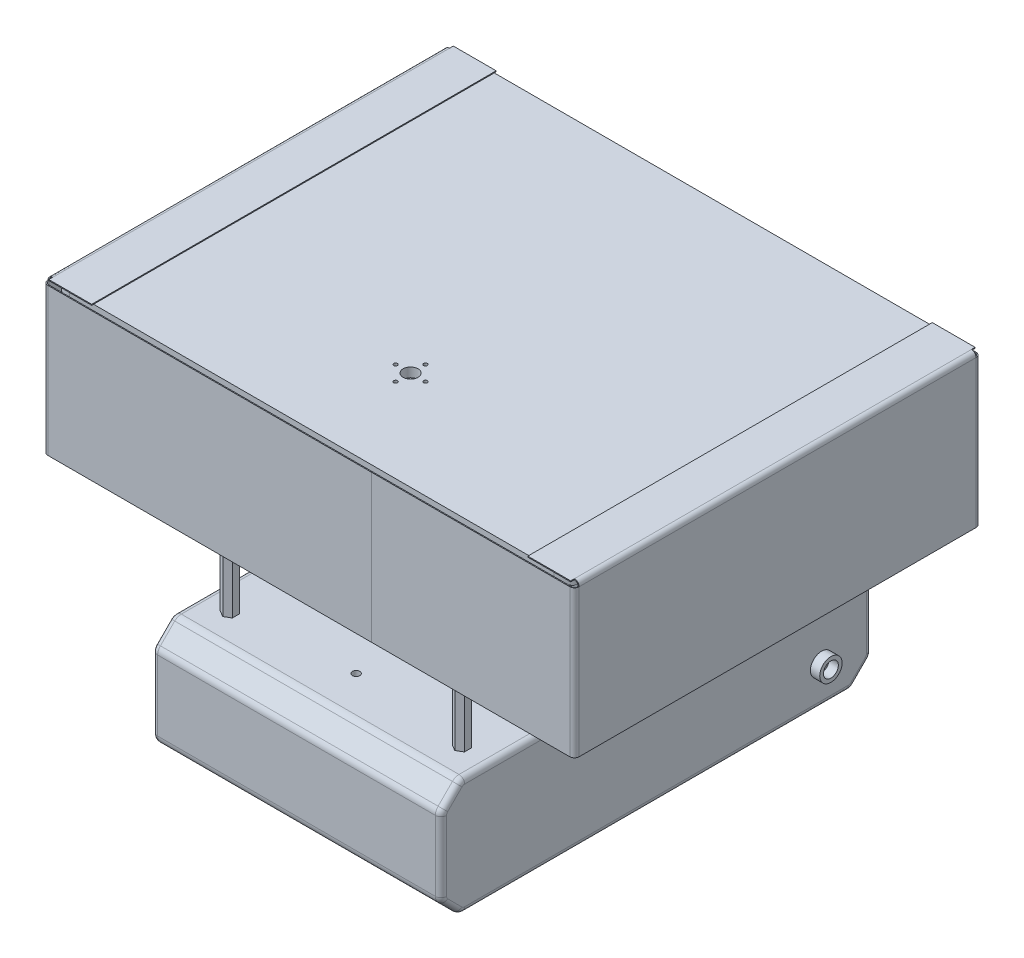
from build123d import *

# Parameters (mm, degrees)
BOSS_EXTRUDE1_DEPTH                  = 77.5
FILLET1_R                            = 5
FILLET2_R                            = 3
SKETCH2_R                            = 6
SKETCH2_R_2                          = 4
BOSS_EXTRUDE2_DEPTH                  = 5
BOSS_EXTRUDE3_DEPTH                  = 44
BOSS_EXTRUDE3_2_DEPTH                = 44
BOSS_EXTRUDE3_3_DEPTH                = 44
BOSS_EXTRUDE3_4_DEPTH                = 44
BOSS_EXTRUDE3_5_DEPTH                = 44
BOSS_EXTRUDE3_6_DEPTH                = 44
BOSS_EXTRUDE4_DEPTH                  = 5
BOSS_EXTRUDE5_DEPTH                  = 71
BOSS_EXTRUDE5_2_DEPTH                = 71
BOSS_EXTRUDE5_3_DEPTH                = 71
BOSS_EXTRUDE5_4_DEPTH                = 71
BOSS_EXTRUDE5_5_DEPTH                = 71
BOSS_EXTRUDE5_6_DEPTH                = 71
BOSS_EXTRUDE6_DEPTH                  = 5
BOSS_EXTRUDE7_DEPTH                  = 17
BOSS_EXTRUDE7_2_DEPTH                = 17
BOSS_EXTRUDE7_3_DEPTH                = 17
BOSS_EXTRUDE7_4_DEPTH                = 17
BOSS_EXTRUDE8_DEPTH                  = 3
TAP_DRILL_FOR_M4X0_7_TAP1_AT_2_COUNT = 2
TAP_DRILL_FOR_M4X0_7_TAP1_AT_2_PITCH = 60.74722325
TAP_DRILL_FOR_M4X0_7_TAP1_AT_3_COUNT = 2
TAP_DRILL_FOR_M4X0_7_TAP1_AT_3_PITCH = 121.494446501
TAP_DRILL_FOR_M4X0_7_TAP1_AT_4_COUNT = 2
TAP_DRILL_FOR_M4X0_7_TAP1_AT_4_PITCH = 283.367077358
TAP_DRILL_FOR_M4X0_7_TAP1_AT_5_COUNT = 2
TAP_DRILL_FOR_M4X0_7_TAP1_AT_5_PITCH = 263.108770535
TAP_DRILL_FOR_M4X0_7_TAP1_AT_6_COUNT = 2
TAP_DRILL_FOR_M4X0_7_TAP1_AT_6_PITCH = 256
TAP_DRILL_FOR_M4X0_7_TAP2_AT_2_COUNT = 2
TAP_DRILL_FOR_M4X0_7_TAP2_AT_2_PITCH = 60.74722325
TAP_DRILL_FOR_M4X0_7_TAP2_AT_3_COUNT = 2
TAP_DRILL_FOR_M4X0_7_TAP2_AT_3_PITCH = 121.494446501
TAP_DRILL_FOR_M4X0_7_TAP2_AT_4_COUNT = 2
TAP_DRILL_FOR_M4X0_7_TAP2_AT_4_PITCH = 283.367077358
TAP_DRILL_FOR_M4X0_7_TAP2_AT_5_COUNT = 2
TAP_DRILL_FOR_M4X0_7_TAP2_AT_5_PITCH = 263.108770535
TAP_DRILL_FOR_M4X0_7_TAP2_AT_6_COUNT = 2
TAP_DRILL_FOR_M4X0_7_TAP2_AT_6_PITCH = 256
SKETCH17_W                           = 25
SKETCH17_H                           = 217
BASE_FLANGE1_DEPTH                   = 0.5
EDGE_FLANGE1_STRIP_W                 = 6
EDGE_FLANGE1_STRIP_H                 = 0.5
EDGE_FLANGE1_STRIP_CUT_DEPTH         = 217
EDGE_FLANGE1_DEPTH                   = 217
EDGE_FLANGE2_START                   = 107
EDGE_FLANGE2_DEPTH                   = 81.5
EDGE_FLANGE2_START_2                 = 186
EDGE_FLANGE2_2_DEPTH                 = 2.5
EDGE_FLANGE2_3_DEPTH                 = 79
EDGE_FLANGE3_START                   = 107
EDGE_FLANGE3_DEPTH                   = 81.5
EDGE_FLANGE3_START_2                 = 186
EDGE_FLANGE3_2_DEPTH                 = 2.5
EDGE_FLANGE3_3_DEPTH                 = 79
SKETCH41_R                           = 4
SKETCH41_R_2                         = 1
CUT_EXTRUDE1_DEPTH                   = 5
SKETCH42_R                           = 2
CUT_EXTRUDE2_DEPTH                   = 63


# Read off the part's stored shape, not the designer's step: Edge-Flange2, Edge-Flange3
# Sheet-metal steps are written as plain solids
with BuildPart() as part:
    # Sketch1 → Boss-Extrude1 (new, symmetric)
    with BuildSketch(Plane(origin=(0, 0, 0), x_dir=(0, 0, -1), z_dir=(1, 0, 0))):
        Polygon((-105, 0), (105, 0), (115.606601718, 10.606601718), (115.606601718, 52.393398282), (105, 63), (-105, 63), (-115.606601718, 52.393398282), (-115.606601718, 10.606601718), align=None)
    extrude(amount=BOSS_EXTRUDE1_DEPTH, both=True)

    # Fillet1
    fillet1_edges = [part.edges().sort_by_distance(p)[0] for p in [
        (0, 10.606601718, 115.606601718),
        (0, 52.393398282, 115.606601718),
        (0, 63, 105),
        (0, 63, -105),
        (0, 52.393398282, -115.606601718),
        (0, 10.606601718, -115.606601718),
        (0, 0, -105),
        (0, 0, 105),
    ]]
    fillet(fillet1_edges, radius=FILLET1_R)

    # Fillet2
    fillet2_edges = [part.edges().sort_by_distance(p)[0] for p in [
        (-77.5, 63, 0),
        (77.5, 63, 0),
        (-77.5, 5.303300859, 110.303300859),
        (-77.5, 31.5, 115.606601718),
        (-77.5, 57.696699141, 110.303300859),
        (-77.5, 57.696699141, -110.303300859),
        (-77.5, 31.5, -115.606601718),
        (-77.5, 5.303300859, -110.303300859),
        (-77.5, 0, 0),
        (-77.5, 62.619397663, 104.84234935),
        (-77.5, 52.235747632, 115.22599938),
        (-77.5, 10.764252368, 115.22599938),
        (-77.5, 0.380602337, 104.84234935),
        (-77.5, 0.380602337, -104.84234935),
        (-77.5, 10.764252368, -115.22599938),
        (-77.5, 52.235747632, -115.22599938),
        (-77.5, 62.619397663, -104.84234935),
        (77.5, 57.696699141, -110.303300859),
        (77.5, 5.303300859, 110.303300859),
        (77.5, 0, 0),
        (77.5, 5.303300859, -110.303300859),
        (77.5, 31.5, -115.606601718),
        (77.5, 57.696699141, 110.303300859),
        (77.5, 31.5, 115.606601718),
        (77.5, 62.619397663, 104.84234935),
        (77.5, 52.235747632, 115.22599938),
        (77.5, 10.764252368, 115.22599938),
        (77.5, 0.380602337, 104.84234935),
        (77.5, 0.380602337, -104.84234935),
        (77.5, 10.764252368, -115.22599938),
        (77.5, 52.235747632, -115.22599938),
        (77.5, 62.619397663, -104.84234935),
    ]]
    fillet(fillet2_edges, radius=FILLET2_R)

    # Sketch2 → Boss-Extrude2 (add)
    with BuildSketch(Plane.ZY.offset(77.5)):
        with Locations((-88.606601718, 20)):
            Circle(SKETCH2_R)
        with Locations((-88.606601718, 20)):
            Circle(SKETCH2_R_2, mode=Mode.SUBTRACT)
    boss_extrude2 = extrude(amount=BOSS_EXTRUDE2_DEPTH)

    # Mirror1: Boss-Extrude2 across plane
    add(boss_extrude2.mirror(Plane(origin=(0, 0, 0), x_dir=(0, 0, 1), z_dir=(1, 0, 0))))

    # Sketch42 → Cut-Extrude2 (cut)
    with BuildSketch(Plane.XZ):
        with Locations(Location((0, 83.642935588, 0), (0, 0, 270))):
            Circle(SKETCH42_R)
    extrude(amount=-CUT_EXTRUDE2_DEPTH, mode=Mode.SUBTRACT)


with BuildPart() as body_2:
    # Sketch3 → Boss-Extrude3 (new body)
    with BuildSketch(Plane(origin=(0, 63, 0), x_dir=(1, 0, 0), z_dir=(0, 1, 0))):
        Polygon((-62.25, 85.423378689), (-59, 87.299767064), (-59, 91.052543813), (-62.25, 92.928932188), (-65.5, 91.052543813), (-65.5, 87.299767064), align=None)
    extrude(amount=BOSS_EXTRUDE3_DEPTH)


with BuildPart() as body_3:
    # Sketch3 → Boss-Extrude3 2 (new body)
    with BuildSketch(Plane(origin=(0, 63, 0), x_dir=(1, 0, 0), z_dir=(0, 1, 0))):
        Polygon((65.5, 87.299767064), (62.25, 85.423378689), (59, 87.299767064), (59, 91.052543813), (62.25, 92.928932188), (65.5, 91.052543813), align=None)
    extrude(amount=BOSS_EXTRUDE3_2_DEPTH)


with BuildPart() as body_4:
    # Sketch3 → Boss-Extrude3 3 (new body)
    with BuildSketch(Plane(origin=(0, 63, 0), x_dir=(1, 0, 0), z_dir=(0, 1, 0))):
        Polygon((-62.25, -3.75277675), (-59, -1.876388375), (-59, 1.876388375), (-62.25, 3.75277675), (-65.5, 1.876388375), (-65.5, -1.876388375), align=None)
    extrude(amount=BOSS_EXTRUDE3_3_DEPTH)


with BuildPart() as body_5:
    # Sketch3 → Boss-Extrude3 4 (new body)
    with BuildSketch(Plane(origin=(0, 63, 0), x_dir=(1, 0, 0), z_dir=(0, 1, 0))):
        Polygon((62.25, -3.75277675), (59, -1.876388375), (59, 1.876388375), (62.25, 3.75277675), (65.5, 1.876388375), (65.5, -1.876388375), align=None)
    extrude(amount=BOSS_EXTRUDE3_4_DEPTH)


with BuildPart() as body_6:
    # Sketch3 → Boss-Extrude3 5 (new body)
    with BuildSketch(Plane(origin=(0, 63, 0), x_dir=(1, 0, 0), z_dir=(0, 1, 0))):
        Polygon((-62.25, -92.928932188), (-59, -91.052543813), (-59, -87.299767064), (-62.25, -85.423378689), (-65.5, -87.299767064), (-65.5, -91.052543813), align=None)
    extrude(amount=BOSS_EXTRUDE3_5_DEPTH)


with BuildPart() as body_7:
    # Sketch3 → Boss-Extrude3 6 (new body)
    with BuildSketch(Plane(origin=(0, 63, 0), x_dir=(1, 0, 0), z_dir=(0, 1, 0))):
        Polygon((62.25, -92.928932188), (59, -91.052543813), (59, -87.299767064), (62.25, -85.423378689), (65.5, -87.299767064), (65.5, -91.052543813), align=None)
    extrude(amount=BOSS_EXTRUDE3_6_DEPTH)


with BuildPart() as body_8:
    # Sketch4 → Boss-Extrude4 (new body)
    with BuildSketch(Plane(origin=(0, 107, 0), x_dir=(1, 0, 0), z_dir=(0, 1, 0))):
        with BuildLine():
            Line((130, -107.5), (-130, -107.5))
            ThreePointArc((-130, -107.5), (-137.071067812, -104.571067812), (-140, -97.5))
            Line((-140, -97.5), (-140, 97.5))
            ThreePointArc((-140, 97.5), (-137.071067812, 104.571067812), (-130, 107.5))
            Line((-130, 107.5), (130, 107.5))
            ThreePointArc((130, 107.5), (137.071067812, 104.571067812), (140, 97.5))
            Line((140, 97.5), (140, -97.5))
            ThreePointArc((140, -97.5), (137.071067812, -104.571067812), (130, -107.5))
        make_face()
    extrude(amount=BOSS_EXTRUDE4_DEPTH)


with BuildPart() as body_9:
    # Sketch5 → Boss-Extrude5 (new body)
    with BuildSketch(Plane(origin=(0, 112, 0), x_dir=(1, 0, 0), z_dir=(0, 1, 0))):
        Polygon((-131.25, 58.870834875), (-128, 56.994446501), (-124.75, 58.870834875), (-124.75, 62.623611625), (-128, 64.5), (-131.25, 62.623611625), align=None)
    extrude(amount=BOSS_EXTRUDE5_DEPTH)


with BuildPart() as body_10:
    # Sketch5 → Boss-Extrude5 2 (new body)
    with BuildSketch(Plane(origin=(0, 112, 0), x_dir=(1, 0, 0), z_dir=(0, 1, 0))):
        Polygon((131.25, 62.623611625), (131.25, 58.870834875), (128, 56.994446501), (124.75, 58.870834875), (124.75, 62.623611625), (128, 64.5), align=None)
    extrude(amount=BOSS_EXTRUDE5_2_DEPTH)


with BuildPart() as body_11:
    # Sketch5 → Boss-Extrude5 3 (new body)
    with BuildSketch(Plane(origin=(0, 112, 0), x_dir=(1, 0, 0), z_dir=(0, 1, 0))):
        Polygon((-128, -3.75277675), (-124.75, -1.876388375), (-124.75, 1.876388375), (-128, 3.75277675), (-131.25, 1.876388375), (-131.25, -1.876388375), align=None)
    extrude(amount=BOSS_EXTRUDE5_3_DEPTH)


with BuildPart() as body_12:
    # Sketch5 → Boss-Extrude5 4 (new body)
    with BuildSketch(Plane(origin=(0, 112, 0), x_dir=(1, 0, 0), z_dir=(0, 1, 0))):
        Polygon((131.25, -1.876388375), (128, -3.75277675), (124.75, -1.876388375), (124.75, 1.876388375), (128, 3.75277675), (131.25, 1.876388375), align=None)
    extrude(amount=BOSS_EXTRUDE5_4_DEPTH)


with BuildPart() as body_13:
    # Sketch5 → Boss-Extrude5 5 (new body)
    with BuildSketch(Plane(origin=(0, 112, 0), x_dir=(1, 0, 0), z_dir=(0, 1, 0))):
        Polygon((-128, -64.5), (-124.75, -62.623611625), (-124.75, -58.870834875), (-128, -56.994446501), (-131.25, -58.870834875), (-131.25, -62.623611625), align=None)
    extrude(amount=BOSS_EXTRUDE5_5_DEPTH)


with BuildPart() as body_14:
    # Sketch5 → Boss-Extrude5 6 (new body)
    with BuildSketch(Plane(origin=(0, 112, 0), x_dir=(1, 0, 0), z_dir=(0, 1, 0))):
        Polygon((131.25, -62.623611625), (128, -64.5), (124.75, -62.623611625), (124.75, -58.870834875), (128, -56.994446501), (131.25, -58.870834875), align=None)
    extrude(amount=BOSS_EXTRUDE5_6_DEPTH)


with BuildPart() as body_15:
    # Sketch6 → Boss-Extrude6 (new body)
    with BuildSketch(Plane(origin=(0, 183, 0), x_dir=(1, 0, 0), z_dir=(0, 1, 0))):
        with BuildLine():
            Line((-140, 97.5), (-140, -97.5))
            ThreePointArc((-140, -97.5), (-137.071067812, -104.571067812), (-130, -107.5))
            Line((-130, -107.5), (130, -107.5))
            ThreePointArc((130, -107.5), (137.071067812, -104.571067812), (140, -97.5))
            Line((140, -97.5), (140, 97.5))
            ThreePointArc((140, 97.5), (137.071067812, 104.571067812), (130, 107.5))
            Line((130, 107.5), (-130, 107.5))
            ThreePointArc((-130, 107.5), (-137.071067812, 104.571067812), (-140, 97.5))
        make_face()
    extrude(amount=BOSS_EXTRUDE6_DEPTH)


with BuildPart() as body_16:
    # Sketch7 → Boss-Extrude7 (new body)
    with BuildSketch(Plane(origin=(0, 112, 0), x_dir=(1, 0, 0), z_dir=(0, 1, 0))):
        Polygon((-53.25, 48.123611625), (-50, 46.24722325), (-46.75, 48.123611625), (-46.75, 51.876388375), (-50, 53.75277675), (-53.25, 51.876388375), align=None)
    extrude(amount=BOSS_EXTRUDE7_DEPTH)


with BuildPart() as body_17:
    # Sketch7 → Boss-Extrude7 2 (new body)
    with BuildSketch(Plane(origin=(0, 112, 0), x_dir=(1, 0, 0), z_dir=(0, 1, 0))):
        Polygon((53.25, 51.876388375), (53.25, 48.123611625), (50, 46.24722325), (46.75, 48.123611625), (46.75, 51.876388375), (50, 53.75277675), align=None)
    extrude(amount=BOSS_EXTRUDE7_2_DEPTH)


with BuildPart() as body_18:
    # Sketch7 → Boss-Extrude7 3 (new body)
    with BuildSketch(Plane(origin=(0, 112, 0), x_dir=(1, 0, 0), z_dir=(0, 1, 0))):
        Polygon((53.25, -48.123611625), (50, -46.24722325), (46.75, -48.123611625), (46.75, -51.876388375), (50, -53.75277675), (53.25, -51.876388375), align=None)
    extrude(amount=BOSS_EXTRUDE7_3_DEPTH)


with BuildPart() as body_19:
    # Sketch7 → Boss-Extrude7 4 (new body)
    with BuildSketch(Plane(origin=(0, 112, 0), x_dir=(1, 0, 0), z_dir=(0, 1, 0))):
        Polygon((-53.25, -51.876388375), (-53.25, -48.123611625), (-50, -46.24722325), (-46.75, -48.123611625), (-46.75, -51.876388375), (-50, -53.75277675), align=None)
    extrude(amount=BOSS_EXTRUDE7_4_DEPTH)


with BuildPart() as body_20:
    # Sketch8 → Boss-Extrude8 (new body)
    with BuildSketch(Plane(origin=(0, 129, 0), x_dir=(1, 0, 0), z_dir=(0, 1, 0))):
        with BuildLine():
            Line((52.5, -62.5), (-52.5, -62.5))
            ThreePointArc((-52.5, -62.5), (-59.571067812, -59.571067812), (-62.5, -52.5))
            Line((-62.5, -52.5), (-62.5, 52.5))
            ThreePointArc((-62.5, 52.5), (-59.571067812, 59.571067812), (-52.5, 62.5))
            Line((-52.5, 62.5), (52.5, 62.5))
            ThreePointArc((52.5, 62.5), (59.571067812, 59.571067812), (62.5, 52.5))
            Line((62.5, 52.5), (62.5, -52.5))
            ThreePointArc((62.5, -52.5), (59.571067812, -59.571067812), (52.5, -62.5))
        make_face()
    extrude(amount=BOSS_EXTRUDE8_DEPTH)


with BuildPart() as tap_drill_for_m4x0_7_tap1_tool:
    # Sketch11 → Tap Drill for M4x0.7 Tap1 (revolve)
    with BuildSketch(Plane(origin=(-128, 188, 60.74722325), x_dir=(0, 0, 1), z_dir=(1, 0, 0))):
        Polygon((0, 0), (0, 12.991420021), (1.65, 12), (1.65, 0), align=None)
    tap_drill_for_m4x0_7_tap1 = revolve(axis=Axis((-128, 194.35, 60.74722325), (0, -1, 0)))


with BuildPart() as body_13_1:
    add(body_13.part)

    # Tap Drill for M4x0.7 Tap1: cut by tap_drill_for_m4x0_7_tap1_tool
    add(tap_drill_for_m4x0_7_tap1_tool.part, mode=Mode.SUBTRACT)


with BuildPart() as body_15_1:
    add(body_15.part)

    # Tap Drill for M4x0.7 Tap1: cut by tap_drill_for_m4x0_7_tap1_tool
    add(tap_drill_for_m4x0_7_tap1_tool.part, mode=Mode.SUBTRACT)


with BuildPart() as tap_drill_for_m4x0_7_tap1_at_2_tool:
    # Tap Drill for M4x0.7 Tap1 at 2: Tap Drill for M4x0.7 Tap1 ×2
    with Locations(*[(0, 0, -i * TAP_DRILL_FOR_M4X0_7_TAP1_AT_2_PITCH) for i in range(1, TAP_DRILL_FOR_M4X0_7_TAP1_AT_2_COUNT)]):
        add(tap_drill_for_m4x0_7_tap1)


with BuildPart() as body_11_1:
    add(body_11.part)

    # Tap Drill for M4x0.7 Tap1 at 2: cut by tap_drill_for_m4x0_7_tap1_at_2_tool
    add(tap_drill_for_m4x0_7_tap1_at_2_tool.part, mode=Mode.SUBTRACT)


with BuildPart() as body_15_2:
    add(body_15_1.part)

    # Tap Drill for M4x0.7 Tap1 at 2: cut by tap_drill_for_m4x0_7_tap1_at_2_tool
    add(tap_drill_for_m4x0_7_tap1_at_2_tool.part, mode=Mode.SUBTRACT)


with BuildPart() as tap_drill_for_m4x0_7_tap1_at_3_tool:
    # Tap Drill for M4x0.7 Tap1 at 3: Tap Drill for M4x0.7 Tap1 ×2
    with Locations(*[(0, 0, -i * TAP_DRILL_FOR_M4X0_7_TAP1_AT_3_PITCH) for i in range(1, TAP_DRILL_FOR_M4X0_7_TAP1_AT_3_COUNT)]):
        add(tap_drill_for_m4x0_7_tap1)


with BuildPart() as body_9_1:
    add(body_9.part)

    # Tap Drill for M4x0.7 Tap1 at 3: cut by tap_drill_for_m4x0_7_tap1_at_3_tool
    add(tap_drill_for_m4x0_7_tap1_at_3_tool.part, mode=Mode.SUBTRACT)


with BuildPart() as body_15_3:
    add(body_15_2.part)

    # Tap Drill for M4x0.7 Tap1 at 3: cut by tap_drill_for_m4x0_7_tap1_at_3_tool
    add(tap_drill_for_m4x0_7_tap1_at_3_tool.part, mode=Mode.SUBTRACT)


with BuildPart() as tap_drill_for_m4x0_7_tap1_at_4_tool:
    # Tap Drill for M4x0.7 Tap1 at 4: Tap Drill for M4x0.7 Tap1 ×2
    with Locations(*[Vector(0.9034218173358387, 0, -0.42875286583486594) * (i * TAP_DRILL_FOR_M4X0_7_TAP1_AT_4_PITCH) for i in range(1, TAP_DRILL_FOR_M4X0_7_TAP1_AT_4_COUNT)]):
        add(tap_drill_for_m4x0_7_tap1)


with BuildPart() as body_10_1:
    add(body_10.part)

    # Tap Drill for M4x0.7 Tap1 at 4: cut by tap_drill_for_m4x0_7_tap1_at_4_tool
    add(tap_drill_for_m4x0_7_tap1_at_4_tool.part, mode=Mode.SUBTRACT)


with BuildPart() as body_15_4:
    add(body_15_3.part)

    # Tap Drill for M4x0.7 Tap1 at 4: cut by tap_drill_for_m4x0_7_tap1_at_4_tool
    add(tap_drill_for_m4x0_7_tap1_at_4_tool.part, mode=Mode.SUBTRACT)


with BuildPart() as tap_drill_for_m4x0_7_tap1_at_5_tool:
    # Tap Drill for M4x0.7 Tap1 at 5: Tap Drill for M4x0.7 Tap1 ×2
    with Locations(*[Vector(0.972981628393172, 0, -0.23088254765003635) * (i * TAP_DRILL_FOR_M4X0_7_TAP1_AT_5_PITCH) for i in range(1, TAP_DRILL_FOR_M4X0_7_TAP1_AT_5_COUNT)]):
        add(tap_drill_for_m4x0_7_tap1)


with BuildPart() as body_12_1:
    add(body_12.part)

    # Tap Drill for M4x0.7 Tap1 at 5: cut by tap_drill_for_m4x0_7_tap1_at_5_tool
    add(tap_drill_for_m4x0_7_tap1_at_5_tool.part, mode=Mode.SUBTRACT)


with BuildPart() as body_15_5:
    add(body_15_4.part)

    # Tap Drill for M4x0.7 Tap1 at 5: cut by tap_drill_for_m4x0_7_tap1_at_5_tool
    add(tap_drill_for_m4x0_7_tap1_at_5_tool.part, mode=Mode.SUBTRACT)


with BuildPart() as tap_drill_for_m4x0_7_tap1_at_6_tool:
    # Tap Drill for M4x0.7 Tap1 at 6: Tap Drill for M4x0.7 Tap1 ×2
    with Locations(*[(i * TAP_DRILL_FOR_M4X0_7_TAP1_AT_6_PITCH, 0, 0) for i in range(1, TAP_DRILL_FOR_M4X0_7_TAP1_AT_6_COUNT)]):
        add(tap_drill_for_m4x0_7_tap1)


with BuildPart() as body_14_1:
    add(body_14.part)

    # Tap Drill for M4x0.7 Tap1 at 6: cut by tap_drill_for_m4x0_7_tap1_at_6_tool
    add(tap_drill_for_m4x0_7_tap1_at_6_tool.part, mode=Mode.SUBTRACT)


with BuildPart() as body_15_6:
    add(body_15_5.part)

    # Tap Drill for M4x0.7 Tap1 at 6: cut by tap_drill_for_m4x0_7_tap1_at_6_tool
    add(tap_drill_for_m4x0_7_tap1_at_6_tool.part, mode=Mode.SUBTRACT)

    # Sketch41 → Cut-Extrude1 (cut)
    with BuildSketch(Plane(origin=(0, 188, 0), x_dir=(1, 0, 0), z_dir=(0, 1, 0))):
        with Locations(Location((0, -54.420564453, 0), (0, 0, 270))):
            Circle(SKETCH41_R)
        with Locations(Location((0, -46.420564453, 0), (0, 0, 270))):
            Circle(SKETCH41_R_2)
        with Locations(Location((-8.009435547, -54.43, 0), (0, 0, 270))):
            Circle(SKETCH41_R_2)
        with Locations(Location((0, -62.439435547, 0), (0, 0, 270))):
            Circle(SKETCH41_R_2)
        with Locations(Location((8.009435547, -54.43, 0), (0, 0, 270))):
            Circle(SKETCH41_R_2)
    extrude(amount=-CUT_EXTRUDE1_DEPTH, mode=Mode.SUBTRACT)


with BuildPart() as tap_drill_for_m4x0_7_tap2_tool:
    # Sketch15 → Tap Drill for M4x0.7 Tap2 (revolve)
    with BuildSketch(Plane(origin=(-128, 107, 60.74722325), x_dir=(0, 0, -1), z_dir=(1, 0, 0))):
        Polygon((0, 0), (0, 12.991420021), (1.65, 12), (1.65, 0), align=None)
    tap_drill_for_m4x0_7_tap2 = revolve(axis=Axis((-128, 100.65, 60.74722325), (0, 1, 0)))


with BuildPart() as body_8_1:
    add(body_8.part)

    # Tap Drill for M4x0.7 Tap2: cut by tap_drill_for_m4x0_7_tap2_tool
    add(tap_drill_for_m4x0_7_tap2_tool.part, mode=Mode.SUBTRACT)


with BuildPart() as body_13_2:
    add(body_13_1.part)

    # Tap Drill for M4x0.7 Tap2: cut by tap_drill_for_m4x0_7_tap2_tool
    add(tap_drill_for_m4x0_7_tap2_tool.part, mode=Mode.SUBTRACT)


with BuildPart() as tap_drill_for_m4x0_7_tap2_at_2_tool:
    # Tap Drill for M4x0.7 Tap2 at 2: Tap Drill for M4x0.7 Tap2 ×2
    with Locations(*[(0, 0, -i * TAP_DRILL_FOR_M4X0_7_TAP2_AT_2_PITCH) for i in range(1, TAP_DRILL_FOR_M4X0_7_TAP2_AT_2_COUNT)]):
        add(tap_drill_for_m4x0_7_tap2)


with BuildPart() as body_8_2:
    add(body_8_1.part)

    # Tap Drill for M4x0.7 Tap2 at 2: cut by tap_drill_for_m4x0_7_tap2_at_2_tool
    add(tap_drill_for_m4x0_7_tap2_at_2_tool.part, mode=Mode.SUBTRACT)


with BuildPart() as body_11_2:
    add(body_11_1.part)

    # Tap Drill for M4x0.7 Tap2 at 2: cut by tap_drill_for_m4x0_7_tap2_at_2_tool
    add(tap_drill_for_m4x0_7_tap2_at_2_tool.part, mode=Mode.SUBTRACT)


with BuildPart() as tap_drill_for_m4x0_7_tap2_at_3_tool:
    # Tap Drill for M4x0.7 Tap2 at 3: Tap Drill for M4x0.7 Tap2 ×2
    with Locations(*[(0, 0, -i * TAP_DRILL_FOR_M4X0_7_TAP2_AT_3_PITCH) for i in range(1, TAP_DRILL_FOR_M4X0_7_TAP2_AT_3_COUNT)]):
        add(tap_drill_for_m4x0_7_tap2)


with BuildPart() as body_8_3:
    add(body_8_2.part)

    # Tap Drill for M4x0.7 Tap2 at 3: cut by tap_drill_for_m4x0_7_tap2_at_3_tool
    add(tap_drill_for_m4x0_7_tap2_at_3_tool.part, mode=Mode.SUBTRACT)


with BuildPart() as body_9_2:
    add(body_9_1.part)

    # Tap Drill for M4x0.7 Tap2 at 3: cut by tap_drill_for_m4x0_7_tap2_at_3_tool
    add(tap_drill_for_m4x0_7_tap2_at_3_tool.part, mode=Mode.SUBTRACT)


with BuildPart() as tap_drill_for_m4x0_7_tap2_at_4_tool:
    # Tap Drill for M4x0.7 Tap2 at 4: Tap Drill for M4x0.7 Tap2 ×2
    with Locations(*[Vector(0.9034218173358387, 0, -0.42875286583486594) * (i * TAP_DRILL_FOR_M4X0_7_TAP2_AT_4_PITCH) for i in range(1, TAP_DRILL_FOR_M4X0_7_TAP2_AT_4_COUNT)]):
        add(tap_drill_for_m4x0_7_tap2)


with BuildPart() as body_8_4:
    add(body_8_3.part)

    # Tap Drill for M4x0.7 Tap2 at 4: cut by tap_drill_for_m4x0_7_tap2_at_4_tool
    add(tap_drill_for_m4x0_7_tap2_at_4_tool.part, mode=Mode.SUBTRACT)


with BuildPart() as body_10_2:
    add(body_10_1.part)

    # Tap Drill for M4x0.7 Tap2 at 4: cut by tap_drill_for_m4x0_7_tap2_at_4_tool
    add(tap_drill_for_m4x0_7_tap2_at_4_tool.part, mode=Mode.SUBTRACT)


with BuildPart() as tap_drill_for_m4x0_7_tap2_at_5_tool:
    # Tap Drill for M4x0.7 Tap2 at 5: Tap Drill for M4x0.7 Tap2 ×2
    with Locations(*[Vector(0.972981628393172, 0, -0.23088254765003635) * (i * TAP_DRILL_FOR_M4X0_7_TAP2_AT_5_PITCH) for i in range(1, TAP_DRILL_FOR_M4X0_7_TAP2_AT_5_COUNT)]):
        add(tap_drill_for_m4x0_7_tap2)


with BuildPart() as body_8_5:
    add(body_8_4.part)

    # Tap Drill for M4x0.7 Tap2 at 5: cut by tap_drill_for_m4x0_7_tap2_at_5_tool
    add(tap_drill_for_m4x0_7_tap2_at_5_tool.part, mode=Mode.SUBTRACT)


with BuildPart() as body_12_2:
    add(body_12_1.part)

    # Tap Drill for M4x0.7 Tap2 at 5: cut by tap_drill_for_m4x0_7_tap2_at_5_tool
    add(tap_drill_for_m4x0_7_tap2_at_5_tool.part, mode=Mode.SUBTRACT)


with BuildPart() as tap_drill_for_m4x0_7_tap2_at_6_tool:
    # Tap Drill for M4x0.7 Tap2 at 6: Tap Drill for M4x0.7 Tap2 ×2
    with Locations(*[(i * TAP_DRILL_FOR_M4X0_7_TAP2_AT_6_PITCH, 0, 0) for i in range(1, TAP_DRILL_FOR_M4X0_7_TAP2_AT_6_COUNT)]):
        add(tap_drill_for_m4x0_7_tap2)


with BuildPart() as body_8_6:
    add(body_8_5.part)

    # Tap Drill for M4x0.7 Tap2 at 6: cut by tap_drill_for_m4x0_7_tap2_at_6_tool
    add(tap_drill_for_m4x0_7_tap2_at_6_tool.part, mode=Mode.SUBTRACT)


with BuildPart() as body_14_2:
    add(body_14_1.part)

    # Tap Drill for M4x0.7 Tap2 at 6: cut by tap_drill_for_m4x0_7_tap2_at_6_tool
    add(tap_drill_for_m4x0_7_tap2_at_6_tool.part, mode=Mode.SUBTRACT)


with BuildPart() as body_21:
    # Sketch17 → Base-Flange1 (new body)
    with BuildSketch(Plane(origin=(0, 188, 0), x_dir=(1, 0, 0), z_dir=(0, 1, 0))):
        with Locations((129.5, 0)):
            Rectangle(SKETCH17_W, SKETCH17_H)
    extrude(amount=BASE_FLANGE1_DEPTH)

    # Edge-Flange1 strip (across the edge) → Edge-Flange1 strip cut (cut)
    with BuildSketch(Plane(origin=(142, 188, -108.5), x_dir=(-1, 0, 0), z_dir=(0, 0, 1))):
        with Locations((-1, -0.25)):
            Rectangle(EDGE_FLANGE1_STRIP_W, EDGE_FLANGE1_STRIP_H)
    extrude(amount=EDGE_FLANGE1_STRIP_CUT_DEPTH, mode=Mode.SUBTRACT)

    # Edge-Flange1 section (across the edge) → Edge-Flange1 (add)
    with BuildSketch(Plane(origin=(142, 188, -108.5), x_dir=(-1, 0, 0), z_dir=(0, 0, 1))):
        with BuildLine():
            Line((-0.5, 2), (-0.5, 81))
            Line((-0.5, 81), (0, 81))
            Line((0, 81), (0, 2))
            ThreePointArc((0, 2), (0.585786438, 0.585786438), (2, 0))
            Line((2, 0), (2, -0.5))
            ThreePointArc((2, -0.5), (0.232233047, 0.232233047), (-0.5, 2))
        make_face()
    extrude(amount=EDGE_FLANGE1_DEPTH)


with BuildPart() as body_22:
    # Mirror2: mirrored copy
    add(body_21.part.mirror(Plane(origin=(0, 0, 0), x_dir=(0, 0, 1), z_dir=(1, 0, 0))))

    # Edge-Flange3 outline → Edge-Flange3 (cut)
    with BuildSketch(Plane(origin=(0, 0, 0), x_dir=(1, 0, 0), z_dir=(0, 1, 0)).offset(EDGE_FLANGE3_START)):
        with BuildLine():
            ThreePointArc((-142, -106.5), (-141.414213562, -107.914213562), (-140, -108.5))
            Line((-140, -108.5), (-140, -106.5))
            Line((-140, -106.5), (-142, -106.5))
        make_face()
        with BuildLine():
            ThreePointArc((-141.5, -108.5), (-142.236067978, -107.618033989), (-142.5, -106.5))
            Line((-142.5, -106.5), (-142.5, -108.5))
            Line((-142.5, -108.5), (-141.5, -108.5))
        make_face()
        with BuildLine():
            ThreePointArc((-140, 108.5), (-141.414213562, 107.914213562), (-142, 106.5))
            Line((-142, 106.5), (-140, 106.5))
            Line((-140, 106.5), (-140, 108.5))
        make_face()
        with BuildLine():
            Line((-142.5, 108.5), (-142.5, 106.5))
            ThreePointArc((-142.5, 106.5), (-142.236067978, 107.618033989), (-141.5, 108.5))
            Line((-141.5, 108.5), (-142.5, 108.5))
        make_face()
    extrude(amount=EDGE_FLANGE3_DEPTH, mode=Mode.SUBTRACT)

    # Edge-Flange3 2 outline → Edge-Flange3 2 (cut)
    with BuildSketch(Plane(origin=(0, 0, 0), x_dir=(1, 0, 0), z_dir=(0, 1, 0)).offset(EDGE_FLANGE3_START_2)):
        with BuildLine():
            Line((-141.5, -108.5), (-140, -108.5))
            ThreePointArc((-140, -108.5), (-141.414213562, -107.914213562), (-142, -106.5))
            Line((-142, -106.5), (-142.5, -106.5))
            ThreePointArc((-142.5, -106.5), (-142.236067978, -107.618033989), (-141.5, -108.5))
        make_face()
        with BuildLine():
            ThreePointArc((-141.5, 108.5), (-142.236067978, 107.618033989), (-142.5, 106.5))
            Line((-142.5, 106.5), (-142, 106.5))
            ThreePointArc((-142, 106.5), (-141.414213562, 107.914213562), (-140, 108.5))
            Line((-140, 108.5), (-141.5, 108.5))
        make_face()
    extrude(amount=EDGE_FLANGE3_2_DEPTH, mode=Mode.SUBTRACT)

    # Edge-Flange3 3 outline → Edge-Flange3 3 (add)
    with BuildSketch(Plane(origin=(0, 0, 0), x_dir=(1, 0, 0), z_dir=(0, 1, 0)).offset(EDGE_FLANGE3_START)):
        with BuildLine():
            ThreePointArc((-142, -108), (-141.118033989, -108.736067978), (-140, -109))
            Line((-140, -109), (33.5, -109))
            Line((33.5, -109), (33.5, -108.5))
            Line((33.5, -108.5), (-140, -108.5))
            ThreePointArc((-140, -108.5), (-141.414213562, -107.914213562), (-142, -106.5))
            Line((-142, -106.5), (-142, -108))
        make_face()
        with BuildLine():
            Line((-142, 108), (-142, 106.5))
            ThreePointArc((-142, 106.5), (-141.414213562, 107.914213562), (-140, 108.5))
            Line((-140, 108.5), (33.5, 108.5))
            Line((33.5, 108.5), (33.5, 109))
            Line((33.5, 109), (-140, 109))
            ThreePointArc((-140, 109), (-141.118033989, 108.736067978), (-142, 108))
        make_face()
    extrude(amount=EDGE_FLANGE3_3_DEPTH)


with BuildPart() as body_21_1:
    add(body_21.part)

    # Edge-Flange2 outline → Edge-Flange2 (cut)
    with BuildSketch(Plane(origin=(0, 0, 0), x_dir=(1, 0, 0), z_dir=(0, 1, 0)).offset(EDGE_FLANGE2_START)):
        with BuildLine():
            Line((140, 108.5), (140, 106.5))
            Line((140, 106.5), (142, 106.5))
            ThreePointArc((142, 106.5), (141.414213562, 107.914213562), (140, 108.5))
        make_face()
        with BuildLine():
            ThreePointArc((141.5, 108.5), (142.236067978, 107.618033989), (142.5, 106.5))
            Line((142.5, 106.5), (142.5, 108.5))
            Line((142.5, 108.5), (141.5, 108.5))
        make_face()
        with BuildLine():
            ThreePointArc((140, -108.5), (141.414213562, -107.914213562), (142, -106.5))
            Line((142, -106.5), (140, -106.5))
            Line((140, -106.5), (140, -108.5))
        make_face()
        with BuildLine():
            Line((142.5, -108.5), (142.5, -106.5))
            ThreePointArc((142.5, -106.5), (142.236067978, -107.618033989), (141.5, -108.5))
            Line((141.5, -108.5), (142.5, -108.5))
        make_face()
    extrude(amount=EDGE_FLANGE2_DEPTH, mode=Mode.SUBTRACT)

    # Edge-Flange2 2 outline → Edge-Flange2 2 (cut)
    with BuildSketch(Plane(origin=(0, 0, 0), x_dir=(1, 0, 0), z_dir=(0, 1, 0)).offset(EDGE_FLANGE2_START_2)):
        with BuildLine():
            Line((141.5, 108.5), (140, 108.5))
            ThreePointArc((140, 108.5), (141.414213562, 107.914213562), (142, 106.5))
            Line((142, 106.5), (142.5, 106.5))
            ThreePointArc((142.5, 106.5), (142.236067978, 107.618033989), (141.5, 108.5))
        make_face()
        with BuildLine():
            ThreePointArc((141.5, -108.5), (142.236067978, -107.618033989), (142.5, -106.5))
            Line((142.5, -106.5), (142, -106.5))
            ThreePointArc((142, -106.5), (141.414213562, -107.914213562), (140, -108.5))
            Line((140, -108.5), (141.5, -108.5))
        make_face()
    extrude(amount=EDGE_FLANGE2_2_DEPTH, mode=Mode.SUBTRACT)

    # Edge-Flange2 3 outline → Edge-Flange2 3 (add)
    with BuildSketch(Plane(origin=(0, 0, 0), x_dir=(1, 0, 0), z_dir=(0, 1, 0)).offset(EDGE_FLANGE2_START)):
        with BuildLine():
            ThreePointArc((142, 108), (141.118033989, 108.736067978), (140, 109))
            Line((140, 109), (33.5, 109))
            Line((33.5, 109), (33.5, 108.5))
            Line((33.5, 108.5), (140, 108.5))
            ThreePointArc((140, 108.5), (141.414213562, 107.914213562), (142, 106.5))
            Line((142, 106.5), (142, 108))
        make_face()
        with BuildLine():
            Line((142, -108), (142, -106.5))
            ThreePointArc((142, -106.5), (141.414213562, -107.914213562), (140, -108.5))
            Line((140, -108.5), (33.5, -108.5))
            Line((33.5, -108.5), (33.5, -109))
            Line((33.5, -109), (140, -109))
            ThreePointArc((140, -109), (141.118033989, -108.736067978), (142, -108))
        make_face()
    extrude(amount=EDGE_FLANGE2_3_DEPTH)


solid = Compound([part.part, body_2.part, body_3.part, body_4.part, body_5.part, body_6.part, body_7.part, body_16.part, body_17.part, body_18.part, body_19.part, body_20.part, body_15_6.part, body_13_2.part, body_11_2.part, body_9_2.part, body_10_2.part, body_12_2.part, body_8_6.part, body_14_2.part, body_22.part, body_21_1.part])
